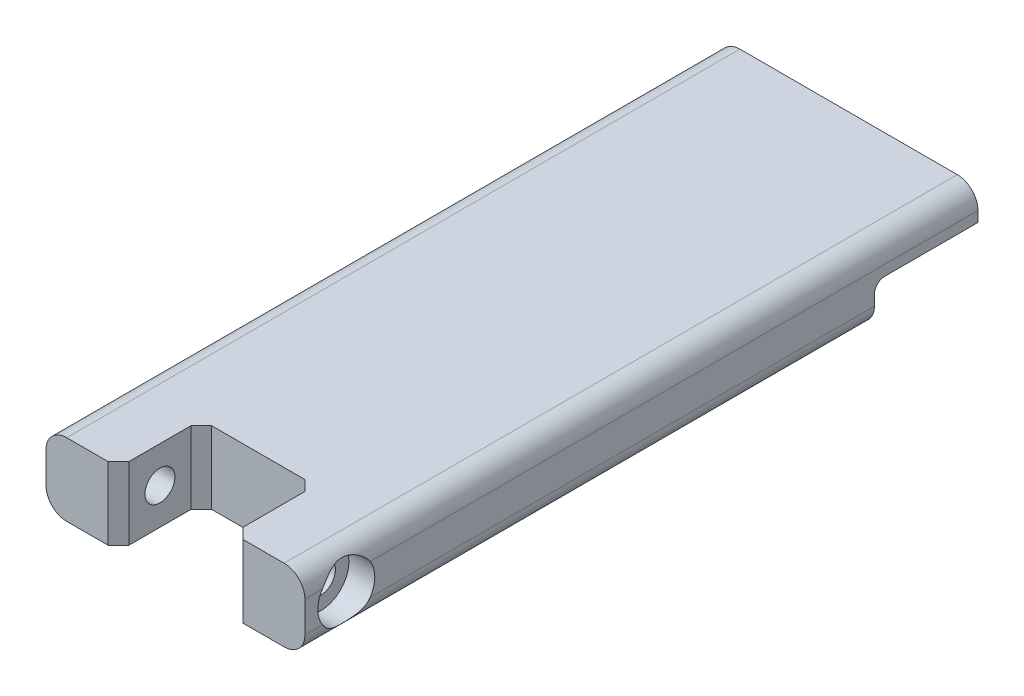
from build123d import *

# Parameters (mm, degrees)
SKETCH1_W                        = 25
SKETCH1_H                        = 7
BOSS_EXTRUDE1_DEPTH              = 65
SKETCH2_W                        = 11
SKETCH2_H                        = 8
CUT_EXTRUDE1_DEPTH               = 67.560123197
CHAMFER1_SIZE                    = 1
CBORE_FOR_M2_5_SHCS2_D           = 2.9
CBORE_FOR_M2_5_SHCS2_CBORE_D     = 5.5
CBORE_FOR_M2_5_SHCS2_CBORE_DEPTH = 2.5
FILLET1_R                        = 2
CHAMFER2_SIZE                    = 1
SKETCH10_W                       = 25
SKETCH10_H                       = 4
CUT_EXTRUDE2_DEPTH               = 10
FILLET2_R                        = 1


with BuildPart() as part:
    # Sketch1 → Boss-Extrude1 (new body)
    with BuildSketch(Plane.XY):
        Rectangle(SKETCH1_W, SKETCH1_H)
    extrude(amount=BOSS_EXTRUDE1_DEPTH)

    # Sketch2 → Cut-Extrude1 (cut, through all)
    with BuildSketch(Plane(origin=(0, 3.5, 0), x_dir=(1, 0, 0), z_dir=(0, 1, 0))):
        with Locations((0, -61)):
            Rectangle(SKETCH2_W, SKETCH2_H)
    extrude(amount=-CUT_EXTRUDE1_DEPTH, mode=Mode.SUBTRACT)

    # Chamfer1
    chamfer1_edges = [part.edges().sort_by_distance(p)[0] for p in [
        (-5.5, 0, 57),
        (5.5, 0, 57),
    ]]
    chamfer(chamfer1_edges, length=CHAMFER1_SIZE)

    # CBORE for M2.5 SHCS2 (through all)
    with Locations(Plane(origin=(12.5, -6.575007997, 116.706532938), x_dir=(0, 0, -1), z_dir=(1, 0, 0))):
        with Locations((55.706532938, 6.575007997)):
            CounterBoreHole(CBORE_FOR_M2_5_SHCS2_D / 2, CBORE_FOR_M2_5_SHCS2_CBORE_D / 2, CBORE_FOR_M2_5_SHCS2_CBORE_DEPTH)

    # Fillet1
    # the kernel refuses this fillet: 2 mm, written as the material it takes off along each edge
    with BuildSketch(Plane(origin=(12.5, -3.5, -5), x_dir=(-1, 0, 0), z_dir=(0, 0, 1)), Plane(origin=(12.5, 3.5, -5), x_dir=(0, -1, 0), z_dir=(0, 0, 1))) as fillet1_piece_1:
        with BuildLine():
            CenterArc((FILLET1_R, -FILLET1_R), FILLET1_R, 90, 90)
            Line((0, -FILLET1_R), (0, 0))
            Line((0, 0), (FILLET1_R, 0))
        make_face()
    extrude(amount=75, mode=Mode.SUBTRACT)
    with BuildSketch(Plane(origin=(-12.5, -3.5, -5), x_dir=(1, 0, 0), z_dir=(0, 0, 1)), Plane(origin=(-12.5, 3.5, -5), x_dir=(0, -1, 0), z_dir=(0, 0, 1))) as fillet1_piece_2:
        with BuildLine():
            CenterArc((FILLET1_R, FILLET1_R), FILLET1_R, 180, 90)
            Line((0, FILLET1_R), (0, 0))
            Line((0, 0), (FILLET1_R, 0))
        make_face()
    extrude(amount=75, mode=Mode.SUBTRACT)

    # Chamfer2
    chamfer2_edges = [part.edges().sort_by_distance(p)[0] for p in [
        (-5.5, 0, 65),
        (5.5, 0, 65),
    ]]
    chamfer(chamfer2_edges, length=CHAMFER2_SIZE)

    # Sketch10 → Cut-Extrude2 (cut)
    with BuildSketch(Plane(origin=(0, 0, 0), x_dir=(-1, 0, 0), z_dir=(0, 0, -1))):
        with Locations((0, -1.5)):
            Rectangle(SKETCH10_W, SKETCH10_H)
    extrude(amount=-CUT_EXTRUDE2_DEPTH, mode=Mode.SUBTRACT)

    # Fillet2
    fillet2_edges = [part.edges().sort_by_distance(p)[0] for p in [
        (0, 0.5, 10),
    ]]
    fillet(fillet2_edges, radius=FILLET2_R)


solid = part.part
